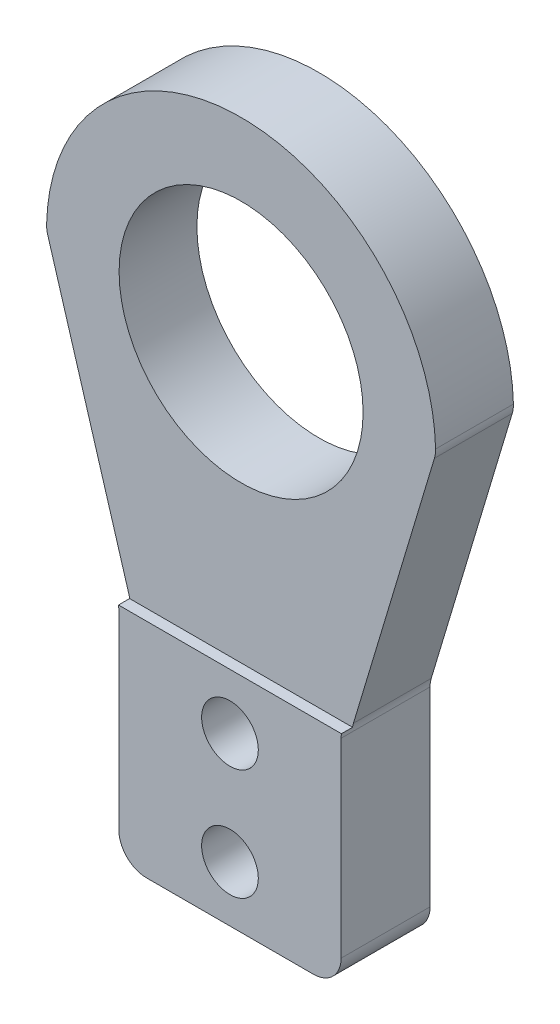
from build123d import *

# Parameters (mm, degrees)
SKETCH1_R           = 2.55
BOSS_EXTRUDE2_DEPTH = 8
FILLET1_R           = 2.5
SKETCH3_R           = 10.975
CUT_EXTRUDE2_DEPTH  = 52.247971305
SKETCH6_W           = 40
SKETCH6_H           = 50
CUT_EXTRUDE5_DEPTH  = 1


with BuildPart() as part:
    # Sketch1 → Boss-Extrude2 (new body)
    with BuildSketch(Plane.XY):
        with BuildLine():
            Line((-10, -15), (-10, 5))
            Line((-10, 5), (-17.5, 30))
            ThreePointArc((-17.5, 30), (0, 47.5), (17.5, 30))
            Line((17.5, 30), (10, 5))
            Line((10, 5), (10, -15))
            Line((10, -15), (-10, -15))
        make_face()
        Circle(SKETCH1_R, mode=Mode.SUBTRACT)
        with Locations((0, -10)):
            Circle(SKETCH1_R, mode=Mode.SUBTRACT)
    extrude(amount=BOSS_EXTRUDE2_DEPTH)

    # Fillet1
    fillet1_edges = [part.edges().sort_by_distance(p)[0] for p in [
        (-17.5, 30, 4),
        (17.5, 30, 4),
        (10, 5, 4),
        (10, -15, 4),
        (-10, -15, 4),
        (-10, 5, 4),
    ]]
    fillet(fillet1_edges, radius=FILLET1_R)

    # Sketch3 → Cut-Extrude2 (cut, through all)
    with BuildSketch(Plane.XY.offset(8)):
        with Locations((0, 30)):
            Circle(SKETCH3_R)
    extrude(amount=-CUT_EXTRUDE2_DEPTH, mode=Mode.SUBTRACT)

    # Sketch6 → Cut-Extrude5 (cut)
    with BuildSketch(Plane.XY.offset(8)):
        with Locations((0, 30)):
            Rectangle(SKETCH6_W, SKETCH6_H)
    extrude(amount=-CUT_EXTRUDE5_DEPTH, mode=Mode.SUBTRACT)


solid = part.part
